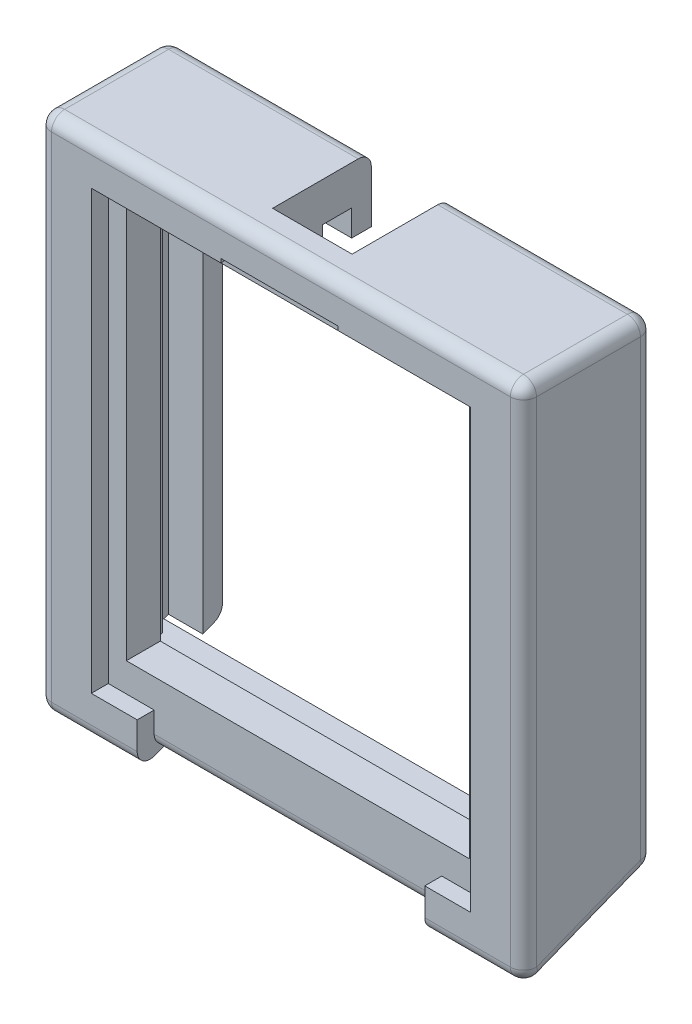
from build123d import *
from OCP.BRepFilletAPI import BRepFilletAPI_MakeChamfer

# Parameters (mm, degrees)
BOSS_EXTRUDE1_START    = -18.55
BOSS_EXTRUDE1_DEPTH    = 4.04
BOSS_EXTRUDE1_START_2  = -14.51
BOSS_EXTRUDE1_2_DEPTH  = 1.38
BOSS_EXTRUDE1_3_DEPTH  = 1.5
BOSS_EXTRUDE1_4_DEPTH  = 0.24
BOSS_EXTRUDE1_5_DEPTH  = 0.08
BOSS_EXTRUDE1_START_3  = 14.51
BOSS_EXTRUDE1_6_DEPTH  = 4.04
BOSS_EXTRUDE1_START_4  = 13.13
BOSS_EXTRUDE1_7_DEPTH  = 1.38
BOSS_EXTRUDE1_START_5  = 17.05
BOSS_EXTRUDE1_8_DEPTH  = 1.5
BOSS_EXTRUDE1_START_6  = 14.27
BOSS_EXTRUDE1_9_DEPTH  = 0.24
BOSS_EXTRUDE1_START_7  = 14.43
BOSS_EXTRUDE1_10_DEPTH = 0.08
BOSS_EXTRUDE2_START    = -17.05
BOSS_EXTRUDE2_DEPTH    = 34.1
FILLET1_R              = 1
SKETCH5_W              = 22
SKETCH5_H              = 3.109151444
SKETCH5_W_2            = 8.973474185
SKETCH5_H_2            = 2.258096186
CUT_EXTRUDE1_DEPTH     = 1.3
CHAMFER1_SIZE          = 0.7
FILLET2_R              = 1
SKETCH6_W              = 6.08
SKETCH6_H              = 25.074252642
CUT_EXTRUDE2_DEPTH     = 7.55
CHAMFER3_SIZE          = 1
CHAMFER3_SIZE2         = 1.191753593


with BuildPart() as part:
    # Boss-Extrude1: read off the stored shape, not the designer's step
    # Boss-Extrude1 outline → Boss-Extrude1 (new body)
    with BuildSketch(Plane.YZ.offset(BOSS_EXTRUDE1_START)):
        Polygon((-11.240546545, -1.8), (25.1, -1.8), (25.1, -0.3), (-11.829296545, -0.3), align=None)
        Polygon((-12.712421545, 1.95), (25.1, 1.95), (25.1, 8.15), (-15.145921545, 8.15), align=None)
    extrude(amount=BOSS_EXTRUDE1_DEPTH)

    # Boss-Extrude1 2 outline → Boss-Extrude1 2 (add)
    with BuildSketch(Plane.YZ.offset(BOSS_EXTRUDE1_START_2)):
        Polygon((-13.340421545, 3.55), (25.1, 3.55), (25.1, 6.85), (-14.635671545, 6.85), align=None)
    extrude(amount=BOSS_EXTRUDE1_2_DEPTH)

    # Boss-Extrude1 3 outline → Boss-Extrude1 3 (add)
    with BuildSketch(Plane.YZ.offset(BOSS_EXTRUDE1_START)):
        Polygon((-11.829296545, -0.3), (25.1, -0.3), (25.1, 1.95), (-12.712421545, 1.95), align=None)
    extrude(amount=BOSS_EXTRUDE1_3_DEPTH)

    # Boss-Extrude1 4 outline → Boss-Extrude1 4 (add)
    with BuildSketch(Plane.YZ.offset(BOSS_EXTRUDE1_START_2)):
        Polygon((-12.712421545, 1.95), (25.1, 1.95), (25.1, 3.55), (-13.340421545, 3.55), align=None)
    extrude(amount=BOSS_EXTRUDE1_4_DEPTH)

    # Boss-Extrude1 5 outline → Boss-Extrude1 5 (add)
    with BuildSketch(Plane.YZ.offset(BOSS_EXTRUDE1_START_2)):
        Polygon((-11.240546545, -1.8), (25.1, -1.8), (25.1, -0.3), (-11.829296545, -0.3), align=None)
    extrude(amount=BOSS_EXTRUDE1_5_DEPTH)



with BuildPart() as body_2:
    # Boss-Extrude1 6 outline → Boss-Extrude1 6 (new body)
    with BuildSketch(Plane.YZ.offset(BOSS_EXTRUDE1_START_3)):
        Polygon((-11.240546545, -1.8), (25.1, -1.8), (25.1, -0.3), (-11.829296545, -0.3), align=None)
        Polygon((-12.712421545, 1.95), (25.1, 1.95), (25.1, 8.15), (-15.145921545, 8.15), align=None)
    extrude(amount=BOSS_EXTRUDE1_6_DEPTH)

    # Boss-Extrude1 7 outline → Boss-Extrude1 7 (add)
    with BuildSketch(Plane.YZ.offset(BOSS_EXTRUDE1_START_4)):
        Polygon((-13.340421545, 3.55), (25.1, 3.55), (25.1, 6.85), (-14.635671545, 6.85), align=None)
    extrude(amount=BOSS_EXTRUDE1_7_DEPTH)

    # Boss-Extrude1 8 outline → Boss-Extrude1 8 (add)
    with BuildSketch(Plane.YZ.offset(BOSS_EXTRUDE1_START_5)):
        Polygon((-11.829296545, -0.3), (25.1, -0.3), (25.1, 1.95), (-12.712421545, 1.95), align=None)
    extrude(amount=BOSS_EXTRUDE1_8_DEPTH)

    # Boss-Extrude1 9 outline → Boss-Extrude1 9 (add)
    with BuildSketch(Plane.YZ.offset(BOSS_EXTRUDE1_START_6)):
        Polygon((-12.712421545, 1.95), (25.1, 1.95), (25.1, 3.55), (-13.340421545, 3.55), align=None)
    extrude(amount=BOSS_EXTRUDE1_9_DEPTH)

    # Boss-Extrude1 10 outline → Boss-Extrude1 10 (add)
    with BuildSketch(Plane.YZ.offset(BOSS_EXTRUDE1_START_7)):
        Polygon((-11.240546545, -1.8), (25.1, -1.8), (25.1, -0.3), (-11.829296545, -0.3), align=None)
    extrude(amount=BOSS_EXTRUDE1_10_DEPTH)


with BuildPart() as part_1:
    add(part.part)

    add(body_2.part)  # Boss-Extrude2 merges body 2
    # Sketch4 → Boss-Extrude2 (add)
    with BuildSketch(Plane(origin=(0, 0, 0), x_dir=(0, 0, -1), z_dir=(1, 0, 0)).offset(BOSS_EXTRUDE2_START)):
        Polygon((1.8, 25.1), (-8.15, 25.1), (-8.15, 21.9), (-6.85, 21.9), (-6.85, 20.6), (-3.55, 20.6), (-3.55, 21.02), (-1.95, 21.02), (-1.95, 22.1), (0.3, 22.1), (0.3, 20.1), (1.8, 20.1), (1.8, 22.1), align=None)
        Polygon((-3.55, -10.06), (-1.95, -10.06), (-1.95, -12.712421545), (-8.15, -15.145921545), (-8.15, -11.57), (-6.85, -11.57), (-6.85, -9.37), (-3.55, -9.37), align=None)
    extrude(amount=BOSS_EXTRUDE2_DEPTH)

    # Fillet1
    fillet1_edges = [part_1.edges().sort_by_distance(p)[0] for p in [
        (0, -12.712421545, 1.95),
        (0, -15.145921545, 8.15),
    ]]
    fillet(fillet1_edges, radius=FILLET1_R)

    # Sketch5 → Cut-Extrude1 (cut)
    with BuildSketch(Plane.XY.offset(8.15)):
        with Locations((0, -13.124575722)):
            Rectangle(SKETCH5_W, SKETCH5_H)
        with Locations((-0.113262908, 21.070951907)):
            Rectangle(SKETCH5_W_2, SKETCH5_H_2)
    extrude(amount=-CUT_EXTRUDE1_DEPTH, mode=Mode.SUBTRACT)

    # Chamfer1
    # the kernel refuses this chamfer: 0.7 mm, written as the material it takes off along each edge
    with BuildSketch(Plane(origin=(-13.13, 20.6, 3.55), x_dir=(0, 1, 0), z_dir=(1, 0, 0))) as chamfer1_piece_1_section:
        Polygon((CHAMFER1_SIZE, 0), (0, CHAMFER1_SIZE), (0, 0), align=None)
    chamfer1_piece_1 = extrude(amount=26.26, mode=Mode.PRIVATE)
    chamfer1_piece_1 = split(chamfer1_piece_1, bisect_by=Plane(origin=(-13.13, 21.02, 3.55), z_dir=(0, -1, 0)), keep=Keep.TOP, mode=Mode.PRIVATE)
    add(chamfer1_piece_1, mode=Mode.SUBTRACT)
    with BuildSketch(Plane(origin=(13.13, -9.37, 3.55), x_dir=(1, 0, 0), z_dir=(0, 1, 0))) as chamfer1_piece_2:
        Polygon((CHAMFER1_SIZE, 0), (0, -CHAMFER1_SIZE), (0, 0), align=None)
    extrude(amount=29.97, mode=Mode.SUBTRACT)
    with BuildSketch(Plane(origin=(-13.13, -9.37, 3.55), x_dir=(0, -1, 0), z_dir=(1, 0, 0))) as chamfer1_piece_3_section:
        Polygon((CHAMFER1_SIZE, 0), (0, -CHAMFER1_SIZE), (0, 0), align=None)
    chamfer1_piece_3 = extrude(amount=26.26, mode=Mode.PRIVATE)
    chamfer1_piece_3 = split(chamfer1_piece_3, bisect_by=Plane(origin=(-13.13, -10.06, 3.55), z_dir=(0, 1, 0)), keep=Keep.TOP, mode=Mode.PRIVATE)
    add(chamfer1_piece_3, mode=Mode.SUBTRACT)
    with BuildSketch(Plane(origin=(-13.13, -9.37, 3.55), x_dir=(-1, 0, 0), z_dir=(0, 1, 0))) as chamfer1_piece_4:
        Polygon((CHAMFER1_SIZE, 0), (0, CHAMFER1_SIZE), (0, 0), align=None)
    extrude(amount=29.97, mode=Mode.SUBTRACT)
    with BuildSketch(Plane(origin=(-14.930178092, 20.6, 3.55), x_dir=(0, 1, 0), z_dir=(1, 0, 0))) as chamfer1_piece_5a_section:
        Polygon((CHAMFER1_SIZE, 0), (0, CHAMFER1_SIZE), (0, 0), align=None)
    chamfer1_piece_5a = extrude(amount=28.060178092, mode=Mode.PRIVATE)
    chamfer1_piece_5a = split(chamfer1_piece_5a, bisect_by=Plane(origin=(-14.27, 20.6, 3.55), z_dir=(1, 0, 0)), keep=Keep.TOP, mode=Mode.PRIVATE)
    chamfer1_piece_5a = split(chamfer1_piece_5a, bisect_by=Plane(origin=(-14.930178092, 21.02, 3.55), z_dir=(0, -1, 0)), keep=Keep.TOP, mode=Mode.PRIVATE)
    chamfer1_piece_5a = split(chamfer1_piece_5a, bisect_by=Plane(origin=(-13.13, 20.6, 3.55), z_dir=(-1, 0, 0)), keep=Keep.TOP, mode=Mode.PRIVATE)
    with BuildSketch(Plane(origin=(-13.13, -9.37, 3.55), x_dir=(-1, 0, 0), z_dir=(0, 1, 0))) as chamfer1_piece_5b_section:
        Polygon((CHAMFER1_SIZE, 0), (0, CHAMFER1_SIZE), (0, 0), align=None)
    chamfer1_piece_5b = extrude(amount=31.770178092, mode=Mode.PRIVATE)
    chamfer1_piece_5b = split(chamfer1_piece_5b, bisect_by=Plane(origin=(-13.13, 21.02, 3.55), z_dir=(0, -1, 0)), keep=Keep.TOP, mode=Mode.PRIVATE)
    chamfer1_piece_5b = split(chamfer1_piece_5b, bisect_by=Plane(origin=(-13.13, 20.6, 3.55), z_dir=(0, 1, 0)), keep=Keep.TOP, mode=Mode.PRIVATE)
    chamfer1_piece_5 = chamfer1_piece_5a & chamfer1_piece_5b
    add(chamfer1_piece_5, mode=Mode.SUBTRACT)
    with BuildSketch(Plane(origin=(-13.13, 20.6, 3.55), x_dir=(0, 1, 0), z_dir=(1, 0, 0))) as chamfer1_piece_6a_section:
        Polygon((CHAMFER1_SIZE, 0), (0, CHAMFER1_SIZE), (0, 0), align=None)
    chamfer1_piece_6a = extrude(amount=28.060178092, mode=Mode.PRIVATE)
    chamfer1_piece_6a = split(chamfer1_piece_6a, bisect_by=Plane(origin=(-13.13, 21.02, 3.55), z_dir=(0, -1, 0)), keep=Keep.TOP, mode=Mode.PRIVATE)
    chamfer1_piece_6a = split(chamfer1_piece_6a, bisect_by=Plane(origin=(14.27, 20.6, 3.55), z_dir=(-1, 0, 0)), keep=Keep.TOP, mode=Mode.PRIVATE)
    chamfer1_piece_6a = split(chamfer1_piece_6a, bisect_by=Plane(origin=(13.13, 20.6, 3.55), z_dir=(1, 0, 0)), keep=Keep.TOP, mode=Mode.PRIVATE)
    with BuildSketch(Plane(origin=(13.13, -9.37, 3.55), x_dir=(1, 0, 0), z_dir=(0, 1, 0))) as chamfer1_piece_6b_section:
        Polygon((CHAMFER1_SIZE, 0), (0, -CHAMFER1_SIZE), (0, 0), align=None)
    chamfer1_piece_6b = extrude(amount=31.770178092, mode=Mode.PRIVATE)
    chamfer1_piece_6b = split(chamfer1_piece_6b, bisect_by=Plane(origin=(13.13, 21.02, 3.55), z_dir=(0, -1, 0)), keep=Keep.TOP, mode=Mode.PRIVATE)
    chamfer1_piece_6b = split(chamfer1_piece_6b, bisect_by=Plane(origin=(13.13, 20.6, 3.55), z_dir=(0, 1, 0)), keep=Keep.TOP, mode=Mode.PRIVATE)
    chamfer1_piece_6 = chamfer1_piece_6a & chamfer1_piece_6b
    add(chamfer1_piece_6, mode=Mode.SUBTRACT)
    with BuildSketch(Plane(origin=(13.13, -11.170178092, 3.55), x_dir=(1, 0, 0), z_dir=(0, 1, 0))) as chamfer1_piece_7a_section:
        Polygon((CHAMFER1_SIZE, 0), (0, -CHAMFER1_SIZE), (0, 0), align=None)
    chamfer1_piece_7a = extrude(amount=31.770178092, mode=Mode.PRIVATE)
    chamfer1_piece_7a = split(chamfer1_piece_7a, bisect_by=Plane(origin=(13.13, -10.06, 3.55), z_dir=(0, 1, 0)), keep=Keep.TOP, mode=Mode.PRIVATE)
    chamfer1_piece_7a = split(chamfer1_piece_7a, bisect_by=Plane(origin=(13.13, -9.37, 3.55), z_dir=(0, -1, 0)), keep=Keep.TOP, mode=Mode.PRIVATE)
    with BuildSketch(Plane(origin=(-13.13, -9.37, 3.55), x_dir=(0, -1, 0), z_dir=(1, 0, 0))) as chamfer1_piece_7b_section:
        Polygon((CHAMFER1_SIZE, 0), (0, -CHAMFER1_SIZE), (0, 0), align=None)
    chamfer1_piece_7b = extrude(amount=28.060178092, mode=Mode.PRIVATE)
    chamfer1_piece_7b = split(chamfer1_piece_7b, bisect_by=Plane(origin=(-13.13, -10.06, 3.55), z_dir=(0, 1, 0)), keep=Keep.TOP, mode=Mode.PRIVATE)
    chamfer1_piece_7b = split(chamfer1_piece_7b, bisect_by=Plane(origin=(14.27, -9.37, 3.55), z_dir=(-1, 0, 0)), keep=Keep.TOP, mode=Mode.PRIVATE)
    chamfer1_piece_7b = split(chamfer1_piece_7b, bisect_by=Plane(origin=(13.13, -9.37, 3.55), z_dir=(1, 0, 0)), keep=Keep.TOP, mode=Mode.PRIVATE)
    chamfer1_piece_7 = chamfer1_piece_7a & chamfer1_piece_7b
    add(chamfer1_piece_7, mode=Mode.SUBTRACT)
    with BuildSketch(Plane(origin=(-14.930178092, -9.37, 3.55), x_dir=(0, -1, 0), z_dir=(1, 0, 0))) as chamfer1_piece_8a_section:
        Polygon((CHAMFER1_SIZE, 0), (0, -CHAMFER1_SIZE), (0, 0), align=None)
    chamfer1_piece_8a = extrude(amount=28.060178092, mode=Mode.PRIVATE)
    chamfer1_piece_8a = split(chamfer1_piece_8a, bisect_by=Plane(origin=(-14.27, -9.37, 3.55), z_dir=(1, 0, 0)), keep=Keep.TOP, mode=Mode.PRIVATE)
    chamfer1_piece_8a = split(chamfer1_piece_8a, bisect_by=Plane(origin=(-14.930178092, -10.06, 3.55), z_dir=(0, 1, 0)), keep=Keep.TOP, mode=Mode.PRIVATE)
    chamfer1_piece_8a = split(chamfer1_piece_8a, bisect_by=Plane(origin=(-13.13, -9.37, 3.55), z_dir=(-1, 0, 0)), keep=Keep.TOP, mode=Mode.PRIVATE)
    with BuildSketch(Plane(origin=(-13.13, -11.170178092, 3.55), x_dir=(-1, 0, 0), z_dir=(0, 1, 0))) as chamfer1_piece_8b_section:
        Polygon((CHAMFER1_SIZE, 0), (0, CHAMFER1_SIZE), (0, 0), align=None)
    chamfer1_piece_8b = extrude(amount=31.770178092, mode=Mode.PRIVATE)
    chamfer1_piece_8b = split(chamfer1_piece_8b, bisect_by=Plane(origin=(-13.13, -10.06, 3.55), z_dir=(0, 1, 0)), keep=Keep.TOP, mode=Mode.PRIVATE)
    chamfer1_piece_8b = split(chamfer1_piece_8b, bisect_by=Plane(origin=(-13.13, -9.37, 3.55), z_dir=(0, -1, 0)), keep=Keep.TOP, mode=Mode.PRIVATE)
    chamfer1_piece_8 = chamfer1_piece_8a & chamfer1_piece_8b
    add(chamfer1_piece_8, mode=Mode.SUBTRACT)

    # Fillet2
    # the kernel refuses this fillet: 1 mm, written as the material it takes off along each edge
    with BuildSketch(Plane(origin=(-17.55, 24.1, 7.15), x_dir=(-1, 0, 0), z_dir=(0, 0, 1))) as fillet2_piece_1_section:
        Polygon((0, 0), (FILLET2_R, 0), (FILLET2_R, -FILLET2_R), (0, -FILLET2_R), align=None)
    fillet2_piece_1 = extrude(amount=FILLET2_R, mode=Mode.PRIVATE)
    fillet2_piece_1 = fillet2_piece_1 - Plane(origin=(-17.55, 24.1, 7.15), x_dir=(0.7071067811865475, -0.7071067811865475, 0), z_dir=(0, 0, 1)) * Sphere(FILLET2_R, mode=Mode.PRIVATE)
    add(fillet2_piece_1, mode=Mode.SUBTRACT)
    with BuildSketch(Plane(origin=(17.55, -10.558776444, -0.8), x_dir=(0, 0, -1), z_dir=(1, 0, 0))) as fillet2_piece_2_section:
        Polygon((0, 0), (FILLET2_R, 0), (FILLET2_R, -FILLET2_R * 0.681770101045), (FILLET2_R * 0.365364352613, -FILLET2_R * 0.930864592645), align=None)
    fillet2_piece_2 = extrude(amount=FILLET2_R, mode=Mode.PRIVATE)
    fillet2_piece_2 = fillet2_piece_2 - Plane(origin=(17.55, -10.558776444, -0.8), x_dir=(0, 0.5633097049523215, 0.8262458328527464), z_dir=(1, 0, 0)) * Sphere(FILLET2_R, mode=Mode.PRIVATE)
    add(fillet2_piece_2, mode=Mode.SUBTRACT)
    with BuildSketch(Plane(origin=(-17.55, -10.558776444, -0.8), x_dir=(0, -0.9308645926447314, -0.36536435261305716), z_dir=(-1, 0, 0))) as fillet2_piece_3_section:
        Polygon((0, 0), (FILLET2_R, 0), (FILLET2_R, -FILLET2_R * 0.681770101045), (FILLET2_R * 0.365364352613, -FILLET2_R * 0.930864592645), align=None)
    fillet2_piece_3 = extrude(amount=FILLET2_R, mode=Mode.PRIVATE)
    fillet2_piece_3 = fillet2_piece_3 - Plane(origin=(-17.55, -10.558776444, -0.8), x_dir=(0, 0.5633097049523215, 0.8262458328527464), z_dir=(-1, 0, 0)) * Sphere(FILLET2_R, mode=Mode.PRIVATE)
    add(fillet2_piece_3, mode=Mode.SUBTRACT)
    with BuildSketch(Plane(origin=(17.55, 24.1, 7.15), x_dir=(0, 0, 1), z_dir=(1, 0, 0))) as fillet2_piece_4_section:
        Polygon((0, 0), (FILLET2_R, 0), (FILLET2_R, -FILLET2_R), (0, -FILLET2_R), align=None)
    fillet2_piece_4 = extrude(amount=FILLET2_R, mode=Mode.PRIVATE)
    fillet2_piece_4 = fillet2_piece_4 - Plane(origin=(17.55, 24.1, 7.15), x_dir=(0, -0.7071067811865475, -0.7071067811865475), z_dir=(1, 0, 0)) * Sphere(FILLET2_R, mode=Mode.PRIVATE)
    add(fillet2_piece_4, mode=Mode.SUBTRACT)
    with BuildSketch(Plane(origin=(17.55, 24.1, -0.8), x_dir=(0, 0, -1), z_dir=(1, 0, 0))) as fillet2_piece_5_section:
        Polygon((0, 0), (FILLET2_R, 0), (FILLET2_R, FILLET2_R), (0, FILLET2_R), align=None)
    fillet2_piece_5 = extrude(amount=FILLET2_R, mode=Mode.PRIVATE)
    fillet2_piece_5 = fillet2_piece_5 - Plane(origin=(17.55, 24.1, -0.8), x_dir=(0, -0.7071067811865475, 0.7071067811865475), z_dir=(1, 0, 0)) * Sphere(FILLET2_R, mode=Mode.PRIVATE)
    add(fillet2_piece_5, mode=Mode.SUBTRACT)
    with BuildSketch(Plane(origin=(-17.55, 24.1, -0.8), x_dir=(-1, 0, 0), z_dir=(0, 0, -1))) as fillet2_piece_6_section:
        Polygon((0, 0), (FILLET2_R, 0), (FILLET2_R, FILLET2_R), (0, FILLET2_R), align=None)
    fillet2_piece_6 = extrude(amount=FILLET2_R, mode=Mode.PRIVATE)
    fillet2_piece_6 = fillet2_piece_6 - Plane(origin=(-17.55, 24.1, -0.8), x_dir=(0.7071067811865475, -0.7071067811865475, 0), z_dir=(0, 0, -1)) * Sphere(FILLET2_R, mode=Mode.PRIVATE)
    add(fillet2_piece_6, mode=Mode.SUBTRACT)
    with BuildSketch(Plane(origin=(-18.55, 24.1, 8.15), x_dir=(0, 0, -1), z_dir=(0, -1, 0))) as fillet2_piece_7:
        with BuildLine():
            CenterArc((FILLET2_R, FILLET2_R), FILLET2_R, 180, 90)
            Line((0, FILLET2_R), (0, 0))
            Line((0, 0), (FILLET2_R, 0))
        make_face()
    extrude(amount=37.779151444, mode=Mode.SUBTRACT)
    with BuildSketch(Plane(origin=(18.55, -11.489641037, -1.165364353), x_dir=(0, 0.9308645926447314, 0.36536435261305694), z_dir=(0, -0.365364352613057, 0.9308645926447315)), Plane(origin=(-18.55, -14.610016037, 6.784635647), x_dir=(0, 0.9308645926447315, 0.365364352613057), z_dir=(0, 0.365364352613057, -0.9308645926447315))) as fillet2_piece_8:
        with BuildLine():
            CenterArc((FILLET2_R, FILLET2_R), FILLET2_R, 180, 90)
            Line((0, FILLET2_R), (0, 0))
            Line((0, 0), (FILLET2_R, 0))
        make_face()
    extrude(amount=8.540447303, mode=Mode.SUBTRACT)
    with BuildSketch(Plane(origin=(12.725574747, -11.240546545, -1.8), x_dir=(0, 1, 0), z_dir=(1, 0, 0)), Plane(origin=(-17.55, -11.240546545, -1.8), x_dir=(0, 1, 0), z_dir=(1, 0, 0))) as fillet2_piece_9:
        with BuildLine():
            CenterArc((FILLET2_R * 0.681770101045, FILLET2_R), FILLET2_R, 201.430007302, 68.569992698)
            Line((-FILLET2_R * 0.249094491599, FILLET2_R * 0.634635647387), (0, 0))
            Line((0, 0), (FILLET2_R * 0.681770101045, 0))
        make_face()
    extrude(amount=4.824425253, mode=Mode.SUBTRACT)
    with BuildSketch(Plane(origin=(-18.55, -13.679151444, 7.15), x_dir=(0, -0.930864592644731, -0.3653643526130583), z_dir=(0, 0.3653643526130583, -0.930864592644731))) as fillet2_piece_10:
        with BuildLine():
            CenterArc((1 - FILLET2_R, -FILLET2_R), FILLET2_R, 0, 90)
            Line((1, -FILLET2_R), (1, 0))
            Line((1, 0), (1 - FILLET2_R, 0))
        make_face()
    revolve(axis=Axis((-18.55, -13.679151444, 7.15), (-1, 0, 0)), revolution_arc=111.430007302, mode=Mode.SUBTRACT)
    with BuildSketch(Plane(origin=(18.55, 24.1, 8.15), x_dir=(0, 0, -1), z_dir=(0, -1, 0))) as fillet2_piece_11:
        with BuildLine():
            CenterArc((FILLET2_R, -FILLET2_R), FILLET2_R, 90, 90)
            Line((0, -FILLET2_R), (0, 0))
            Line((0, 0), (FILLET2_R, 0))
        make_face()
    extrude(amount=37.779151444, mode=Mode.SUBTRACT)
    with BuildSketch(Plane(origin=(18.55, -13.679151444, 7.15), x_dir=(0, -0.9308645926447313, -0.3653643526130575), z_dir=(0, 0.3653643526130575, -0.9308645926447313))) as fillet2_piece_12:
        with BuildLine():
            CenterArc((1 - FILLET2_R, FILLET2_R), FILLET2_R, 270, 90)
            Line((1, FILLET2_R), (1, 0))
            Line((1, 0), (1 - FILLET2_R, 0))
        make_face()
    revolve(axis=Axis((18.55, -13.679151444, 7.15), (-1, 0, 0)), revolution_arc=111.430007302, mode=Mode.SUBTRACT)
    with BuildSketch(Plane(origin=(-11, -14.633090645, 6.85), x_dir=(0, 1, 0), z_dir=(1, 0, 0))) as fillet2_piece_13:
        with BuildLine():
            CenterArc((1.464189201, -1), FILLET2_R, 90, 111.430007302)
            Line((0.533324609, -1.365364353), (0.44023815, -1.401900788))
            ThreePointArc((0.44023815, -1.401900788), (-0.07001185, -0.101900788), (-0.09539392, -0.03))
            Line((-0.09539392, -0.03), (0, 0.1))
            Line((0, 0.1), (1.464189201, 0.1))
            Line((1.464189201, 0.1), (1.464189201, 0))
        make_face()
    extrude(amount=22, mode=Mode.SUBTRACT)
    with BuildSketch(Plane(origin=(17.55, 25.1, -1.8), x_dir=(0, -1, 0), z_dir=(-1, 0, 0))) as fillet2_piece_14:
        with BuildLine():
            CenterArc((FILLET2_R, FILLET2_R), FILLET2_R, 180, 90)
            Line((0, FILLET2_R), (0, 0))
            Line((0, 0), (FILLET2_R, 0))
        make_face()
    extrude(amount=35.1, mode=Mode.SUBTRACT)
    with BuildSketch(Plane(origin=(-18.55, 25.1, -0.8), x_dir=(0, -1, 0), z_dir=(0, 0, 1)), Plane(origin=(18.55, 25.1, 7.15), x_dir=(0, -1, 0), z_dir=(0, 0, -1))) as fillet2_piece_15:
        with BuildLine():
            CenterArc((FILLET2_R, FILLET2_R), FILLET2_R, 180, 90)
            Line((0, FILLET2_R), (0, 0))
            Line((0, 0), (FILLET2_R, 0))
        make_face()
    extrude(amount=7.95, mode=Mode.SUBTRACT)
    with BuildSketch(Plane(origin=(-17.55, 25.1, 8.15), x_dir=(0, 0, -1), z_dir=(1, 0, 0))) as fillet2_piece_16:
        with BuildLine():
            CenterArc((FILLET2_R, -FILLET2_R), FILLET2_R, 90, 90)
            Line((0, -FILLET2_R), (0, 0))
            Line((0, 0), (FILLET2_R, 0))
        make_face()
    extrude(amount=35.1, mode=Mode.SUBTRACT)
    with BuildSketch(Plane(origin=(18.55, -10.558776444, -1.8), x_dir=(0, 0, 1), z_dir=(0, 1, 0)), Plane(origin=(-18.55, -10.558776444, -1.8), x_dir=(1, 0, 0), z_dir=(0, 1, 0))) as fillet2_piece_17:
        with BuildLine():
            CenterArc((FILLET2_R, -FILLET2_R), FILLET2_R, 90, 90)
            Line((0, -FILLET2_R), (0, 0))
            Line((0, 0), (FILLET2_R, 0))
        make_face()
    extrude(amount=34.658776444, mode=Mode.SUBTRACT)

    # Sketch6 → Cut-Extrude2 (cut)
    with BuildSketch(Plane(origin=(0, 0, -1.8), x_dir=(-1, 0, 0), z_dir=(0, 0, -1))):
        with Locations((0, 12.562873679)):
            Rectangle(SKETCH6_W, SKETCH6_H)
    extrude(amount=-CUT_EXTRUDE2_DEPTH, mode=Mode.SUBTRACT)

    # Chamfer3: one chamfer whose edges measure the first distance from different faces: ONE call of the kernel's chamfer builder (chamfer() names one face for all edges)
    chamfer3_edges_1 = [part_1.edges().sort_by_distance(p)[0] for p in [
        (14.27, 5.48, 1.95),
    ]]
    chamfer3_side_1 = [part_1.faces().sort_by_distance(p)[0] for p in [
        (-16.567536388, 5.034674278, 1.95),
    ]]
    chamfer3_edges_2 = [part_1.edges().sort_by_distance(p)[0] for p in [
        (-14.27, 5.48, 1.95),
    ]]
    chamfer3_side_2 = [part_1.faces().sort_by_distance(p)[0] for p in [
        (-14.27, 5.48, 2.75),
    ]]
    chamfer3 = BRepFilletAPI_MakeChamfer(part_1.part.solid().wrapped)
    for e in chamfer3_edges_1:
        chamfer3.Add(CHAMFER3_SIZE, CHAMFER3_SIZE2, e.wrapped, chamfer3_side_1[0].wrapped)  # the first distance lies on this face
    for e in chamfer3_edges_2:
        chamfer3.Add(CHAMFER3_SIZE, CHAMFER3_SIZE2, e.wrapped, chamfer3_side_2[0].wrapped)  # the first distance lies on this face
    add(Compound.cast(chamfer3.Shape()), mode=Mode.REPLACE)


solid = part_1.part
